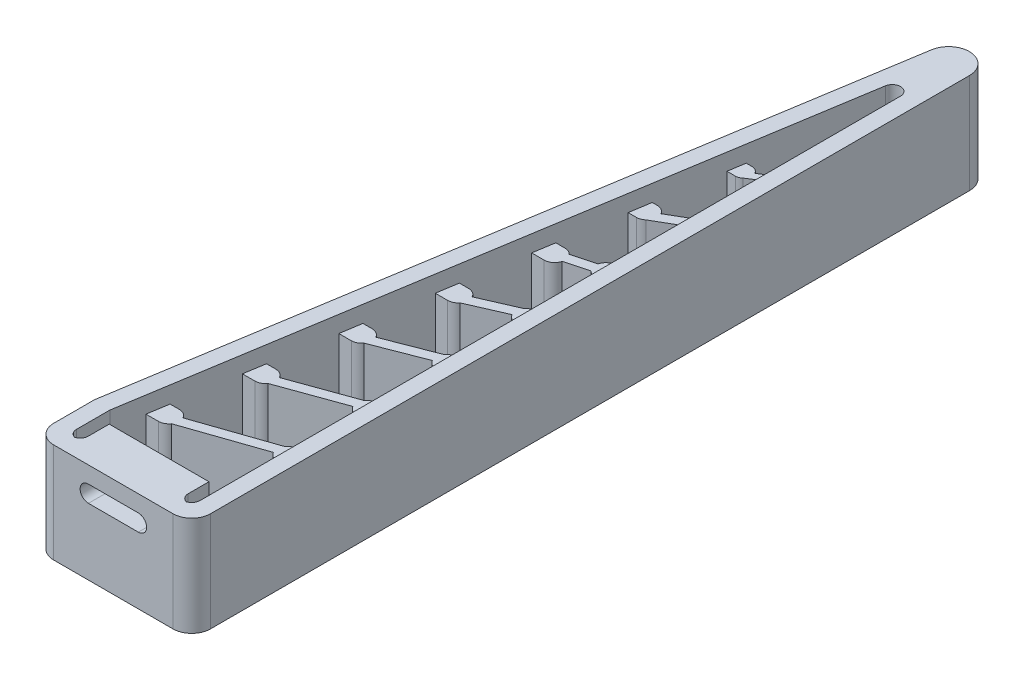
from build123d import *

# Parameters (mm, degrees)
BOSS_EXTRUDE1_DEPTH     = 6
BOSS_EXTRUDE2_DEPTH     = 4
SKETCH6_R               = 0.5
CUT_EXTRUDE1_DEPTH      = 1
FILL_START              = -19.748812638
FILL_PATTERN1_OUTLINE_R = 0.5
FILL_PATTERN1_DEPTH     = 1
FILLET1_R               = 2.25
FILLET2_R               = 1
CUT_EXTRUDE2_DEPTH      = 10


# Read off the part's stored shape, not the designer's step: Fill Pattern1
with BuildPart() as part:
    # Sketch1 → Boss-Extrude1 (new, symmetric)
    with BuildSketch(Plane(origin=(0, 0, 0), x_dir=(1, 0, 0), z_dir=(0, 1, 0))):
        with BuildLine():
            Line((0, 93.551263874), (0, 0))
            Line((0, 0), (-18.854561776, 0))
            Line((-18.854561776, 0), (-18.854561776, 7.158988901))
            Line((-18.854561776, 7.158988901), (-4.96860158, 93.946240126))
            ThreePointArc((-4.96860158, 93.946240126), (-2.301888856, 96.043401906), (0, 93.551263874))
        make_face()
        with BuildLine():
            Line((-16.854561776, 7), (-3.987440632, 87.419507149))
            ThreePointArc((-3.987440632, 87.419507149), (-2.920755543, 88.258371861), (-2, 87.261516648))
            Line((-2, 87.261516648), (-2, 2))
            Line((-2, 2), (-3.427280888, 2))
            Line((-3.427280888, 2), (-3.427280888, 5.5))
            Line((-3.427280888, 5.5), (-15.427280888, 5.5))
            Line((-15.427280888, 5.5), (-15.427280888, 2))
            Line((-15.427280888, 2), (-16.854561776, 2))
            Line((-16.854561776, 2), (-16.854561776, 7))
        make_face(mode=Mode.SUBTRACT)
    extrude(amount=BOSS_EXTRUDE1_DEPTH, both=True)

    # Sketch3 → Boss-Extrude2 (add, symmetric)
    with BuildSketch(Plane(origin=(0, 0, 0), x_dir=(1, 0, 0), z_dir=(0, 1, 0))):
        with BuildLine():
            ThreePointArc((-13.649692995, 12.584606686), (-14.109681305, 13.070807723), (-14.754561776, 13.25))
            Line((-14.754561776, 13.25), (-15.854561776, 13.25))
            Line((-15.854561776, 13.25), (-16.254561776, 10.75))
            Line((-16.254561776, 10.75), (-14.754561776, 10.75))
            ThreePointArc((-14.754561776, 10.75), (-14.174179521, 10.89290631), (-13.726501725, 11.288949699))
            Line((-13.726501725, 11.288949699), (-4.604868781, 14.431044053))
            ThreePointArc((-4.604868781, 14.431044053), (-4.14488047, 13.944843016), (-3.5, 13.765650739))
            Line((-3.5, 13.765650739), (-2, 13.765650739))
            Line((-2, 13.765650739), (-2, 16.265650739))
            Line((-2, 16.265650739), (-3.5, 16.265650739))
            ThreePointArc((-3.5, 16.265650739), (-4.080382255, 16.122744429), (-4.528060051, 15.72670104))
            Line((-4.528060051, 15.72670104), (-13.649692995, 12.584606686))
        make_face()
        with BuildLine():
            ThreePointArc((-3.5, 25.836932031), (-4.075160569, 25.696747475), (-4.521315331, 25.307636544))
            Line((-4.521315331, 25.307636544), (-12.050108229, 22.585390778))
            ThreePointArc((-12.050108229, 22.585390778), (-12.510061377, 23.071036524), (-13.154561776, 23.25))
            Line((-13.154561776, 23.25), (-14.254561776, 23.25))
            Line((-14.254561776, 23.25), (-14.654561776, 20.75))
            Line((-14.654561776, 20.75), (-13.154561776, 20.75))
            ThreePointArc((-13.154561776, 20.75), (-12.579401207, 20.890184556), (-12.133246445, 21.279295487))
            Line((-12.133246445, 21.279295487), (-4.604453547, 24.001541254))
            ThreePointArc((-4.604453547, 24.001541254), (-4.144500399, 23.515895507), (-3.5, 23.336932031))
            Line((-3.5, 23.336932031), (-2, 23.336932031))
            Line((-2, 23.336932031), (-2, 25.836932031))
            Line((-2, 25.836932031), (-3.5, 25.836932031))
        make_face()
        with BuildLine():
            Line((-3.5, 32.908213323), (-2, 32.908213323))
            Line((-2, 32.908213323), (-2, 35.408213323))
            Line((-2, 35.408213323), (-3.5, 35.408213323))
            ThreePointArc((-3.5, 35.408213323), (-4.063500997, 35.273994048), (-4.505989682, 34.900159925))
            Line((-4.505989682, 34.900159925), (-10.452400145, 32.589694616))
            ThreePointArc((-10.452400145, 32.589694616), (-10.912151576, 33.072291535), (-11.554561776, 33.25))
            Line((-11.554561776, 33.25), (-12.654561776, 33.25))
            Line((-12.654561776, 33.25), (-13.054561776, 30.75))
            Line((-13.054561776, 30.75), (-11.554561776, 30.75))
            ThreePointArc((-11.554561776, 30.75), (-10.988400405, 30.885566825), (-10.545043354, 31.262861916))
            Line((-10.545043354, 31.262861916), (-4.603680334, 33.571366051))
            ThreePointArc((-4.603680334, 33.571366051), (-4.143793798, 33.086751917), (-3.5, 32.908213323))
        make_face()
        with BuildLine():
            Line((-3.5, 42.479494615), (-2, 42.479494615))
            Line((-2, 42.479494615), (-2, 44.979494615))
            Line((-2, 44.979494615), (-3.5, 44.979494615))
            ThreePointArc((-3.5, 44.979494615), (-4.046936192, 44.853487855), (-4.483604131, 44.500871899))
            Line((-4.483604131, 44.500871899), (-8.852626028, 42.590116605))
            ThreePointArc((-8.852626028, 42.590116605), (-9.312356885, 43.072414509), (-9.954561776, 43.25))
            Line((-9.954561776, 43.25), (-11.054561776, 43.25))
            Line((-11.054561776, 43.25), (-11.454561776, 40.75))
            Line((-11.454561776, 40.75), (-9.954561776, 40.75))
            ThreePointArc((-9.954561776, 40.75), (-9.407625584, 40.876006761), (-8.970957645, 41.228622717))
            Line((-8.970957645, 41.228622717), (-4.601935748, 43.13937801))
            ThreePointArc((-4.601935748, 43.13937801), (-4.142204891, 42.657080107), (-3.5, 42.479494615))
        make_face()
        with BuildLine():
            ThreePointArc((-3.5, 54.550775907), (-4.272278182, 54.283672855), (-4.714511788, 53.596514163))
            Line((-4.714511788, 53.596514163), (-7.450632841, 52.863372736))
            ThreePointArc((-7.450632841, 52.863372736), (-7.862990784, 53.149285848), (-8.354561776, 53.25))
            Line((-8.354561776, 53.25), (-9.454561776, 53.25))
            Line((-9.454561776, 53.25), (-9.854561776, 50.75))
            Line((-9.854561776, 50.75), (-8.354561776, 50.75))
            ThreePointArc((-8.354561776, 50.75), (-7.582283594, 51.017103052), (-7.140049987, 51.704261745))
            Line((-7.140049987, 51.704261745), (-4.403928934, 52.437403171))
            ThreePointArc((-4.403928934, 52.437403171), (-3.991570992, 52.15149006), (-3.5, 52.050775907))
            Line((-3.5, 52.050775907), (-2, 52.050775907))
            Line((-2, 52.050775907), (-2, 54.550775907))
            Line((-2, 54.550775907), (-3.5, 54.550775907))
        make_face()
        with BuildLine():
            Line((-2, 71.640764886), (-2, 73.640764886))
            Line((-2, 73.640764886), (-2.6, 73.640764886))
            ThreePointArc((-2.6, 73.640764886), (-2.962784917, 73.572637787), (-3.276138866, 73.377539094))
            Line((-3.276138866, 73.377539094), (-4.72720833, 72.461089863))
            ThreePointArc((-4.72720833, 72.461089863), (-5.095471159, 72.854719212), (-5.614561776, 73))
            Line((-5.614561776, 73), (-6.294561776, 73))
            Line((-6.294561776, 73), (-6.614561776, 71))
            Line((-6.614561776, 71), (-5.614561776, 71))
            ThreePointArc((-5.614561776, 71), (-5.251776859, 71.068127099), (-4.93842291, 71.263225792))
            Line((-4.93842291, 71.263225792), (-3.487353446, 72.179675023))
            ThreePointArc((-3.487353446, 72.179675023), (-3.119090617, 71.786045674), (-2.6, 71.640764886))
            Line((-2.6, 71.640764886), (-2, 71.640764886))
        make_face()
        with BuildLine():
            Line((-2, 61.997186069), (-2, 64.497186069))
            Line((-2, 64.497186069), (-2.6, 64.497186069))
            ThreePointArc((-2.6, 64.497186069), (-3.040392748, 64.417038294), (-3.424311098, 64.186872833))
            Line((-3.424311098, 64.186872833), (-6.159837979, 62.603390263))
            ThreePointArc((-6.159837979, 62.603390263), (-6.618848723, 63.076275483), (-7.254561776, 63.25))
            Line((-7.254561776, 63.25), (-7.854561776, 63.25))
            Line((-7.854561776, 63.25), (-8.254561776, 60.75))
            Line((-8.254561776, 60.75), (-7.254561776, 60.75))
            ThreePointArc((-7.254561776, 60.75), (-6.814169028, 60.830147775), (-6.430250678, 61.060313236))
            Line((-6.430250678, 61.060313236), (-3.694723797, 62.643795806))
            ThreePointArc((-3.694723797, 62.643795806), (-3.235713053, 62.170910586), (-2.6, 61.997186069))
            Line((-2.6, 61.997186069), (-2, 61.997186069))
        make_face()
    extrude(amount=BOSS_EXTRUDE2_DEPTH, both=True)

    # Sketch6 → Cut-Extrude1 (cut)
    with BuildSketch(Plane(origin=(-19.500780031, 0, -3.120124805), x_dir=(-0.15799050110667284, 0, 0.9874406319167055), z_dir=(-0.9874406319167055, 0, -0.15799050110667284))):
        with Locations((-47.590234861, 0)):
            Circle(SKETCH6_R)
    extrude(amount=-CUT_EXTRUDE1_DEPTH, mode=Mode.SUBTRACT)

    # Fill Pattern1 outline → Fill Pattern1 (cut)
    with BuildSketch(Plane(origin=(0, 0, 0), x_dir=(0, 1, 0), z_dir=(0.9874406319167054, 0, 0.1579905011066731)).offset(FILL_START)):
        with Locations((3, -44.590234861)):
            Circle(FILL_PATTERN1_OUTLINE_R)
        with Locations((3, -83.590234861)):
            Circle(FILL_PATTERN1_OUTLINE_R)
        with Locations((3, -8.590234861)):
            Circle(FILL_PATTERN1_OUTLINE_R)
        with Locations((0, -8.590234861)):
            Circle(FILL_PATTERN1_OUTLINE_R)
        with Locations((-3, -8.590234861)):
            Circle(FILL_PATTERN1_OUTLINE_R)
        with Locations((-3, -86.590234861)):
            Circle(FILL_PATTERN1_OUTLINE_R)
        with Locations((0, -86.590234861)):
            Circle(FILL_PATTERN1_OUTLINE_R)
        with Locations((3, -86.590234861)):
            Circle(FILL_PATTERN1_OUTLINE_R)
        with Locations((3, -5.590234861)):
            Circle(FILL_PATTERN1_OUTLINE_R)
        with Locations((-3, -80.590234861)):
            Circle(FILL_PATTERN1_OUTLINE_R)
        with Locations((0, -80.590234861)):
            Circle(FILL_PATTERN1_OUTLINE_R)
        with Locations((3, -80.590234861)):
            Circle(FILL_PATTERN1_OUTLINE_R)
        with Locations((3, -11.590234861)):
            Circle(FILL_PATTERN1_OUTLINE_R)
        with Locations((0, -11.590234861)):
            Circle(FILL_PATTERN1_OUTLINE_R)
        with Locations((-3, -11.590234861)):
            Circle(FILL_PATTERN1_OUTLINE_R)
        with Locations((-3, -83.590234861)):
            Circle(FILL_PATTERN1_OUTLINE_R)
        with Locations((0, -83.590234861)):
            Circle(FILL_PATTERN1_OUTLINE_R)
        with Locations((0, -5.590234861)):
            Circle(FILL_PATTERN1_OUTLINE_R)
        with Locations((-3, -5.590234861)):
            Circle(FILL_PATTERN1_OUTLINE_R)
        with Locations((-3, -89.590234861)):
            Circle(FILL_PATTERN1_OUTLINE_R)
        with Locations((0, -89.590234861)):
            Circle(FILL_PATTERN1_OUTLINE_R)
        with Locations((3, -89.590234861)):
            Circle(FILL_PATTERN1_OUTLINE_R)
        with Locations((0, -59.590234861)):
            Circle(FILL_PATTERN1_OUTLINE_R)
        with Locations((-3, -59.590234861)):
            Circle(FILL_PATTERN1_OUTLINE_R)
        with Locations((-3, -35.590234861)):
            Circle(FILL_PATTERN1_OUTLINE_R)
        with Locations((0, -35.590234861)):
            Circle(FILL_PATTERN1_OUTLINE_R)
        with Locations((3, -35.590234861)):
            Circle(FILL_PATTERN1_OUTLINE_R)
        with Locations((3, -56.590234861)):
            Circle(FILL_PATTERN1_OUTLINE_R)
        with Locations((0, -56.590234861)):
            Circle(FILL_PATTERN1_OUTLINE_R)
        with Locations((-3, -56.590234861)):
            Circle(FILL_PATTERN1_OUTLINE_R)
        with Locations((3, -29.590234861)):
            Circle(FILL_PATTERN1_OUTLINE_R)
        with Locations((3, -62.590234861)):
            Circle(FILL_PATTERN1_OUTLINE_R)
        with Locations((0, -62.590234861)):
            Circle(FILL_PATTERN1_OUTLINE_R)
        with Locations((-3, -62.590234861)):
            Circle(FILL_PATTERN1_OUTLINE_R)
        with Locations((-3, -32.590234861)):
            Circle(FILL_PATTERN1_OUTLINE_R)
        with Locations((0, -32.590234861)):
            Circle(FILL_PATTERN1_OUTLINE_R)
        with Locations((3, -32.590234861)):
            Circle(FILL_PATTERN1_OUTLINE_R)
        with Locations((3, -59.590234861)):
            Circle(FILL_PATTERN1_OUTLINE_R)
        with Locations((3, -41.590234861)):
            Circle(FILL_PATTERN1_OUTLINE_R)
        with Locations((3, -47.590234861)):
            Circle(FILL_PATTERN1_OUTLINE_R)
        with Locations((3, -50.590234861)):
            Circle(FILL_PATTERN1_OUTLINE_R)
        with Locations((0, -50.590234861)):
            Circle(FILL_PATTERN1_OUTLINE_R)
        with Locations((-3, -50.590234861)):
            Circle(FILL_PATTERN1_OUTLINE_R)
        with Locations((-3, -47.590234861)):
            Circle(FILL_PATTERN1_OUTLINE_R)
        with Locations((-3, -44.590234861)):
            Circle(FILL_PATTERN1_OUTLINE_R)
        with Locations((0, -44.590234861)):
            Circle(FILL_PATTERN1_OUTLINE_R)
        with Locations((-3, -38.590234861)):
            Circle(FILL_PATTERN1_OUTLINE_R)
        with Locations((0, -38.590234861)):
            Circle(FILL_PATTERN1_OUTLINE_R)
        with Locations((3, -38.590234861)):
            Circle(FILL_PATTERN1_OUTLINE_R)
        with Locations((3, -53.590234861)):
            Circle(FILL_PATTERN1_OUTLINE_R)
        with Locations((0, -53.590234861)):
            Circle(FILL_PATTERN1_OUTLINE_R)
        with Locations((-3, -53.590234861)):
            Circle(FILL_PATTERN1_OUTLINE_R)
        with Locations((-3, -41.590234861)):
            Circle(FILL_PATTERN1_OUTLINE_R)
        with Locations((0, -41.590234861)):
            Circle(FILL_PATTERN1_OUTLINE_R)
        with Locations((3, -17.590234861)):
            Circle(FILL_PATTERN1_OUTLINE_R)
        with Locations((3, -74.590234861)):
            Circle(FILL_PATTERN1_OUTLINE_R)
        with Locations((0, -74.590234861)):
            Circle(FILL_PATTERN1_OUTLINE_R)
        with Locations((-3, -74.590234861)):
            Circle(FILL_PATTERN1_OUTLINE_R)
        with Locations((-3, -20.590234861)):
            Circle(FILL_PATTERN1_OUTLINE_R)
        with Locations((0, -20.590234861)):
            Circle(FILL_PATTERN1_OUTLINE_R)
        with Locations((3, -20.590234861)):
            Circle(FILL_PATTERN1_OUTLINE_R)
        with Locations((3, -71.590234861)):
            Circle(FILL_PATTERN1_OUTLINE_R)
        with Locations((-3, -14.590234861)):
            Circle(FILL_PATTERN1_OUTLINE_R)
        with Locations((0, -14.590234861)):
            Circle(FILL_PATTERN1_OUTLINE_R)
        with Locations((3, -14.590234861)):
            Circle(FILL_PATTERN1_OUTLINE_R)
        with Locations((3, -77.590234861)):
            Circle(FILL_PATTERN1_OUTLINE_R)
        with Locations((0, -77.590234861)):
            Circle(FILL_PATTERN1_OUTLINE_R)
        with Locations((-3, -77.590234861)):
            Circle(FILL_PATTERN1_OUTLINE_R)
        with Locations((-3, -17.590234861)):
            Circle(FILL_PATTERN1_OUTLINE_R)
        with Locations((0, -17.590234861)):
            Circle(FILL_PATTERN1_OUTLINE_R)
        with Locations((-3, -26.590234861)):
            Circle(FILL_PATTERN1_OUTLINE_R)
        with Locations((0, -26.590234861)):
            Circle(FILL_PATTERN1_OUTLINE_R)
        with Locations((3, -26.590234861)):
            Circle(FILL_PATTERN1_OUTLINE_R)
        with Locations((3, -65.590234861)):
            Circle(FILL_PATTERN1_OUTLINE_R)
        with Locations((0, -65.590234861)):
            Circle(FILL_PATTERN1_OUTLINE_R)
        with Locations((-3, -65.590234861)):
            Circle(FILL_PATTERN1_OUTLINE_R)
        with Locations((-3, -29.590234861)):
            Circle(FILL_PATTERN1_OUTLINE_R)
        with Locations((0, -29.590234861)):
            Circle(FILL_PATTERN1_OUTLINE_R)
        with Locations((0, -71.590234861)):
            Circle(FILL_PATTERN1_OUTLINE_R)
        with Locations((-3, -71.590234861)):
            Circle(FILL_PATTERN1_OUTLINE_R)
        with Locations((-3, -23.590234861)):
            Circle(FILL_PATTERN1_OUTLINE_R)
        with Locations((0, -23.590234861)):
            Circle(FILL_PATTERN1_OUTLINE_R)
        with Locations((3, -23.590234861)):
            Circle(FILL_PATTERN1_OUTLINE_R)
        with Locations((3, -68.590234861)):
            Circle(FILL_PATTERN1_OUTLINE_R)
        with Locations((0, -68.590234861)):
            Circle(FILL_PATTERN1_OUTLINE_R)
        with Locations((-3, -68.590234861)):
            Circle(FILL_PATTERN1_OUTLINE_R)
    extrude(amount=FILL_PATTERN1_DEPTH, mode=Mode.SUBTRACT)

    # Fillet1
    fillet1_edges = [part.edges().sort_by_distance(p)[0] for p in [
        (-18.854561776, 0, 0),
        (-18.854561776, 0, -7.158988901),
        (0, 0, 0),
    ]]
    fillet(fillet1_edges, radius=FILLET1_R)

    # Fillet2
    # the kernel refuses this fillet: 1 mm, written as the material it adds along each edge
    with BuildSketch(Plane(origin=(-3.427280888, 6, -2), x_dir=(0, 0, -1), z_dir=(0, -1, 0)), Plane(origin=(-2, 6, -2), x_dir=(-1, 0, 0), z_dir=(0, -1, 0)), Plane(origin=(-15.427280888, 6, -2), x_dir=(-1, 0, 0), z_dir=(0, -1, 0)), Plane(origin=(-16.854561776, 6, -2), x_dir=(0, 0, -1), z_dir=(0, -1, 0))) as fillet2_piece_1:
        with BuildLine():
            CenterArc((FILLET2_R, FILLET2_R), FILLET2_R, 180, 90)
            Line((0, FILLET2_R), (0, 0))
            Line((0, 0), (FILLET2_R, 0))
        make_face()
    extrude(amount=12)

    # Sketch7 → Cut-Extrude2 (cut)
    with BuildSketch(Plane(origin=(0, 0, -5.5), x_dir=(-1, 0, 0), z_dir=(0, 0, -1))):
        with BuildLine():
            Line((12.427280888, 4), (6.427280888, 4))
            ThreePointArc((6.427280888, 4), (5.427280888, 3), (6.427280888, 2))
            Line((6.427280888, 2), (12.427280888, 2))
            ThreePointArc((12.427280888, 2), (13.427280888, 3), (12.427280888, 4))
        make_face()
    extrude(amount=-CUT_EXTRUDE2_DEPTH, mode=Mode.SUBTRACT)


solid = part.part
